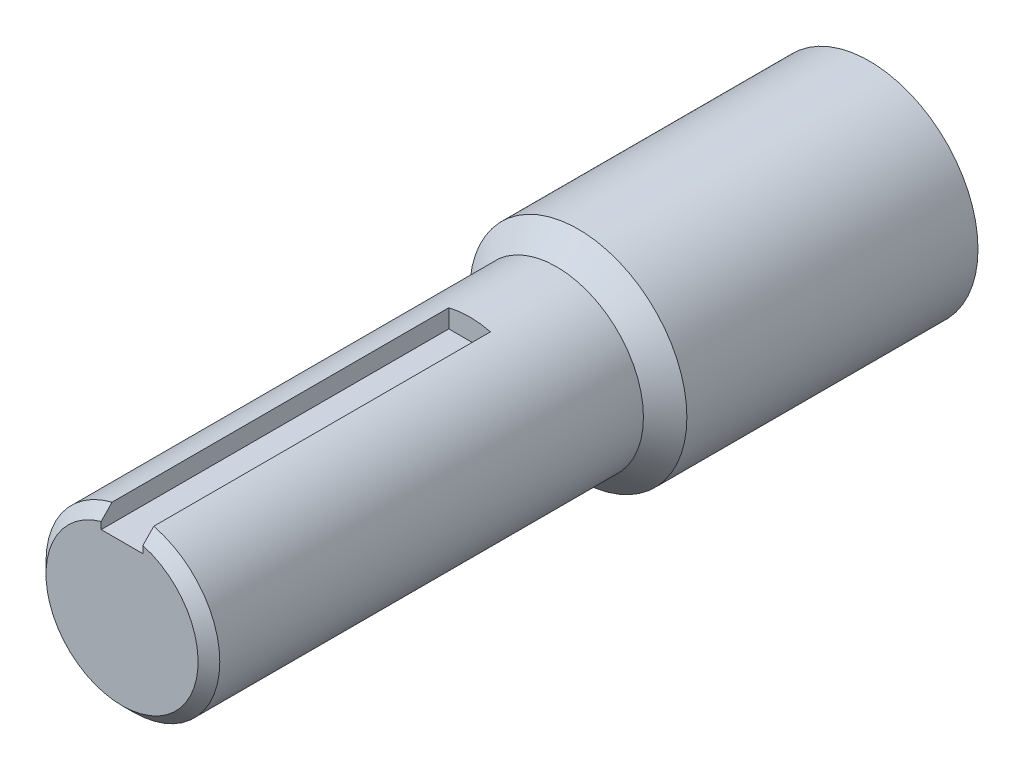
from build123d import *

# Parameters (mm, degrees)
BOSS_EXTRUDE1_DEPTH      = 3.81
BOSS_EXTRUDE1_DEPTH_BACK = 19.05
SKETCH1_R                = 7.9375
SKETCH2_R                = 6.35
BOSS_EXTRUDE2_DEPTH      = 31.75
CHAMFER1_SIZE            = 1.5875
CHAMFER2_SIZE            = 0.79375
SKETCH3_W                = 3.048
SKETCH3_H                = 1.524
CUT_EXTRUDE1_DEPTH       = 25.4


with BuildPart() as part:
    # Sketch1 → Boss-Extrude1 (new, two sides: drawn at the far end of the back side and taken through both)
    with BuildSketch(Plane.XY.offset(-BOSS_EXTRUDE1_DEPTH_BACK)):
        Circle(SKETCH1_R)
    extrude(amount=BOSS_EXTRUDE1_DEPTH + BOSS_EXTRUDE1_DEPTH_BACK)

    # Sketch2 → Boss-Extrude2 (add)
    with BuildSketch(Plane.XY.offset(3.81)):
        Circle(SKETCH2_R)
    extrude(amount=BOSS_EXTRUDE2_DEPTH)

    # Chamfer1
    chamfer1_edges = [part.edges().sort_by_distance(p)[0] for p in [
        (-7.9375, 0, 3.81),
    ]]
    chamfer(chamfer1_edges, length=CHAMFER1_SIZE - 0.0001)  # a hair under: the kernel refuses the full size

    # Chamfer2
    chamfer2_edges = [part.edges().sort_by_distance(p)[0] for p in [
        (-6.35, 0, 35.56),
    ]]
    chamfer(chamfer2_edges, length=CHAMFER2_SIZE)

    # Sketch3 → Cut-Extrude1 (cut)
    with BuildSketch(Plane.XY.offset(35.56)):
        with Locations((0, 5.588)):
            Rectangle(SKETCH3_W, SKETCH3_H)
    extrude(amount=-CUT_EXTRUDE1_DEPTH, mode=Mode.SUBTRACT)


solid = part.part
